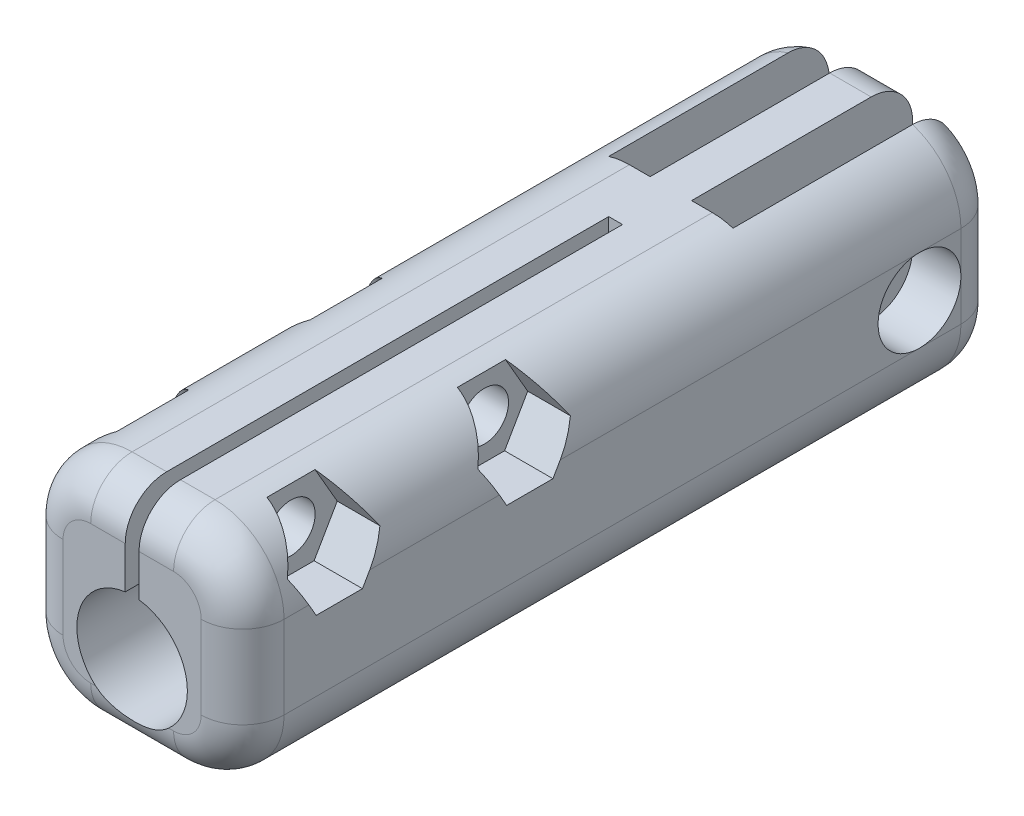
from build123d import *

# Parameters (mm, degrees)
SKETCH1_W               = 16
SKETCH1_H               = 16
BOSS_EXTRUDE1_DEPTH     = 55
SKETCH2_W               = 3
SKETCH2_H               = 16
CUT_EXTRUDE1_DEPTH      = 45
SKETCH3_R               = 3
CUT_EXTRUDE2_DEPTH      = 45
CUT_EXTRUDE3_DEPTH      = 35
FILLET1_R               = 5
FILLET2_R               = 3
CUT_EXTRUDE4_DEPTH      = 40
CUT_EXTRUDE4_DEPTH_BACK = 40
SKETCH5_R               = 1.75
CUT_EXTRUDE5_START      = -4
CUT_EXTRUDE5_DEPTH      = 40
CUT_EXTRUDE6_START      = -5
SKETCH7_R               = 3.5
CUT_EXTRUDE6_DEPTH      = 40


# Some blends are built 0.0001 mm under size
with BuildPart() as part:
    # Sketch1 → Boss-Extrude1 (new body)
    with BuildSketch(Plane.XY):
        Rectangle(SKETCH1_W, SKETCH1_H)
    extrude(amount=BOSS_EXTRUDE1_DEPTH)

    # Sketch2 → Cut-Extrude1 (cut)
    with BuildSketch(Plane(origin=(0, 8, 0), x_dir=(1, 0, 0), z_dir=(0, 1, 0))):
        with Locations((3, -8)):
            Rectangle(SKETCH2_W, SKETCH2_H)
        with Locations((-3, -8)):
            Rectangle(SKETCH2_W, SKETCH2_H)
    extrude(amount=-CUT_EXTRUDE1_DEPTH, mode=Mode.SUBTRACT)

    # Sketch3 → Cut-Extrude2 (cut)
    with BuildSketch(Plane(origin=(8, 0, 0), x_dir=(0, 0, -1), z_dir=(1, 0, 0))):
        with Locations((-6, 0)):
            Circle(SKETCH3_R)
    extrude(amount=-CUT_EXTRUDE2_DEPTH, mode=Mode.SUBTRACT)

    # Sketch4 → Cut-Extrude3 (cut)
    with BuildSketch(Plane.XY.offset(55)):
        with BuildLine():
            Line((0.5, 1.968626967), (0.5, 0.424558432))
            Line((0.5, 0.424558432), (-0.5, 0.424558432))
            Line((-0.5, 0.424558432), (-0.5, 1.968626967))
            ThreePointArc((-0.5, 1.968626967), (-2.645751311, -5), (4, -2))
            ThreePointArc((4, -2), (3, 0.645751311), (0.5, 1.968626967))
        make_face()
        with BuildLine():
            Line((-0.5, 0.424558432), (0.5, 0.424558432))
            Line((0.5, 0.424558432), (0.5, 1.968626967))
            ThreePointArc((0.5, 1.968626967), (0, 2), (-0.5, 1.968626967))
            Line((-0.5, 1.968626967), (-0.5, 0.424558432))
        make_face()
        with BuildLine():
            ThreePointArc((-0.5, 1.968626967), (0, 2), (0.5, 1.968626967))
            Line((0.5, 1.968626967), (0.5, 8))
            Line((0.5, 8), (-0.5, 8))
            Line((-0.5, 8), (-0.5, 1.968626967))
        make_face()
    extrude(amount=-CUT_EXTRUDE3_DEPTH, mode=Mode.SUBTRACT)

    # Fillet1
    fillet1_edges = [part.edges().sort_by_distance(p)[0] for p in [
        (8, 8, 27.5),
        (-8, 8, 27.5),
        (8, -8, 27.5),
        (-8, -8, 27.5),
    ]]
    fillet(fillet1_edges, radius=FILLET1_R - 0.0001)  # a hair under: the kernel refuses the full size

    # Fillet2
    # the kernel refuses this fillet: 3 mm, written as the material it takes off along each edge
    with BuildSketch(Plane(origin=(9, 8, 0), x_dir=(0, -1, 0), z_dir=(-1, 0, 0))) as fillet2_piece_1:
        with BuildLine():
            CenterArc((FILLET2_R, FILLET2_R), FILLET2_R, 180, 90)
            Line((0, FILLET2_R), (0, 0))
            Line((0, 0), (FILLET2_R, 0))
        make_face()
    extrude(amount=18, mode=Mode.SUBTRACT)
    with BuildSketch(Plane(origin=(-9, -8, 0), x_dir=(0, 0, 1), z_dir=(1, 0, 0))) as fillet2_piece_2:
        with BuildLine():
            CenterArc((FILLET2_R, -FILLET2_R), FILLET2_R, 90, 90)
            Line((0, -FILLET2_R), (0, 0))
            Line((0, 0), (FILLET2_R, 0))
        make_face()
    extrude(amount=18, mode=Mode.SUBTRACT)
    with BuildSketch(Plane(origin=(7, 8, 55), x_dir=(0, -1, 0), z_dir=(-1, 0, 0)), Plane(origin=(3.0001, 8, 55), x_dir=(0, -1, 0), z_dir=(-1, 0, 0))) as fillet2_piece_3:
        with BuildLine():
            CenterArc((FILLET2_R, -FILLET2_R), FILLET2_R, 90, 90)
            Line((0, -FILLET2_R), (0, 0))
            Line((0, 0), (FILLET2_R, 0))
        make_face()
    extrude(amount=10.0001, mode=Mode.SUBTRACT)
    with BuildSketch(Plane(origin=(8, -3.0001, 0), x_dir=(0, 0, 1), z_dir=(0, 1, 0)), Plane(origin=(8, -3.0001, 55), x_dir=(-1, 0, 0), z_dir=(0, 1, 0)), Plane(origin=(-8, 3.0001, 55), x_dir=(1, 0, 0), z_dir=(0, -1, 0))) as fillet2_piece_4:
        with BuildLine():
            CenterArc((FILLET2_R, -FILLET2_R), FILLET2_R, 90, 90)
            Line((0, -FILLET2_R), (0, 0))
            Line((0, 0), (FILLET2_R, 0))
        make_face()
    extrude(amount=6.0002, mode=Mode.SUBTRACT)
    with BuildSketch(Plane(origin=(3.0001, -3.0001, 0), x_dir=(-0.9304882617806061, -0.36632170927820573, 0), z_dir=(-0.36632170927820573, 0.9304882617806061, 0))) as fillet2_piece_5_section:
        with BuildLine():
            CenterArc((4.9999 - FILLET2_R, FILLET2_R), FILLET2_R, 270, 90)
            Line((4.9999 - FILLET2_R, 0), (4.9999, 0))
            Line((4.9999, 0), (4.9999, FILLET2_R))
        make_face()
    fillet2_piece_5 = revolve(axis=Axis((3.0001, -3.0001, 0), (0, 0, 1)), revolution_arc=158.511054393, mode=Mode.PRIVATE)
    fillet2_piece_5 = split(fillet2_piece_5, bisect_by=Plane(origin=(4.5, -5.386535126, 0.726343335), z_dir=(1, 0, 0)), keep=Keep.TOP, mode=Mode.PRIVATE)
    add(fillet2_piece_5, mode=Mode.SUBTRACT)
    with BuildSketch(Plane(origin=(3.0001, 3.0001, 0), x_dir=(1, 0, 0), z_dir=(0, -1, 0))) as fillet2_piece_6_section:
        with BuildLine():
            CenterArc((4.9999 - FILLET2_R, FILLET2_R), FILLET2_R, 270, 90)
            Line((4.9999 - FILLET2_R, 0), (4.9999, 0))
            Line((4.9999, 0), (4.9999, FILLET2_R))
        make_face()
    fillet2_piece_6 = revolve(axis=Axis((3.0001, 3.0001, 0), (0, 0, 1)), revolution_arc=158.511054393, mode=Mode.PRIVATE)
    fillet2_piece_6 = split(fillet2_piece_6, bisect_by=Plane(origin=(4.5, 5.386535107, 0.726343714), z_dir=(1, 0, 0)), keep=Keep.TOP, mode=Mode.PRIVATE)
    add(fillet2_piece_6, mode=Mode.SUBTRACT)
    with BuildSketch(Plane(origin=(-3.0001, -8, 55), x_dir=(0, 0, -1), z_dir=(1, 0, 0)), Plane(origin=(-8, 3.0001, 0), x_dir=(1, 0, 0), z_dir=(0, -1, 0))) as fillet2_piece_7:
        with BuildLine():
            CenterArc((FILLET2_R, FILLET2_R), FILLET2_R, 180, 90)
            Line((0, FILLET2_R), (0, 0))
            Line((0, 0), (FILLET2_R, 0))
        make_face()
    extrude(amount=6.0002, mode=Mode.SUBTRACT)
    with BuildSketch(Plane(origin=(-3.0001, -3.0001, 55), x_dir=(0, -1, 0), z_dir=(1, 0, 0))) as fillet2_piece_8:
        with BuildLine():
            CenterArc((4.9999 - FILLET2_R, FILLET2_R), FILLET2_R, 270, 90)
            Line((4.9999 - FILLET2_R, 0), (4.9999, 0))
            Line((4.9999, 0), (4.9999, FILLET2_R))
        make_face()
    revolve(axis=Axis((-3.0001, -3.0001, 55), (0, 0, -1)), revolution_arc=90, mode=Mode.SUBTRACT)
    with BuildSketch(Plane(origin=(3.0001, -3.0001, 55), x_dir=(0, -1, 0), z_dir=(-1, 0, 0))) as fillet2_piece_9:
        with BuildLine():
            CenterArc((4.9999 - FILLET2_R, -FILLET2_R), FILLET2_R, 0, 90)
            Line((4.9999, -FILLET2_R), (4.9999, 0))
            Line((4.9999, 0), (4.9999 - FILLET2_R, 0))
        make_face()
    revolve(axis=Axis((3.0001, -3.0001, 55), (0, 0, 1)), revolution_arc=90, mode=Mode.SUBTRACT)
    with BuildSketch(Plane(origin=(-3.0001, 3.0001, 55), x_dir=(-1, 0, 0), z_dir=(0, -1, 0))) as fillet2_piece_10:
        with BuildLine():
            CenterArc((4.9999 - FILLET2_R, FILLET2_R), FILLET2_R, 270, 90)
            Line((4.9999, FILLET2_R), (4.9999, 0))
            Line((4.9999, 0), (4.9999 - FILLET2_R, 0))
        make_face()
    revolve(axis=Axis((-3.0001, 3.0001, 55), (0, 0, -1)), revolution_arc=90, mode=Mode.SUBTRACT)
    with BuildSketch(Plane(origin=(3.0001, 3.0001, 55), x_dir=(1, 0, 0), z_dir=(0, -1, 0))) as fillet2_piece_11:
        with BuildLine():
            CenterArc((4.9999 - FILLET2_R, -FILLET2_R), FILLET2_R, 0, 90)
            Line((4.9999, -FILLET2_R), (4.9999, 0))
            Line((4.9999, 0), (4.9999 - FILLET2_R, 0))
        make_face()
    revolve(axis=Axis((3.0001, 3.0001, 55), (0, 0, 1)), revolution_arc=90, mode=Mode.SUBTRACT)
    with BuildSketch(Plane(origin=(-3.0001, -3.0001, 0), x_dir=(0.9304882617806057, -0.3663217092782066, 0), z_dir=(0.3663217092782066, 0.9304882617806057, 0))) as fillet2_piece_12_section:
        with BuildLine():
            CenterArc((4.9999 - FILLET2_R, -FILLET2_R), FILLET2_R, 0, 90)
            Line((4.9999 - FILLET2_R, 0), (4.9999, 0))
            Line((4.9999, 0), (4.9999, -FILLET2_R))
        make_face()
    fillet2_piece_12 = revolve(axis=Axis((-3.0001, -3.0001, 0), (0, 0, -1)), revolution_arc=158.511054393, mode=Mode.PRIVATE)
    fillet2_piece_12 = split(fillet2_piece_12, bisect_by=Plane(origin=(-4.5, -5.38653512, 0.72634326), z_dir=(-1, 0, 0)), keep=Keep.TOP, mode=Mode.PRIVATE)
    add(fillet2_piece_12, mode=Mode.SUBTRACT)
    with BuildSketch(Plane(origin=(-3.0001, 3.0001, 0), x_dir=(-1, 0, 0), z_dir=(0, -1, 0))) as fillet2_piece_13_section:
        with BuildLine():
            CenterArc((4.9999 - FILLET2_R, -FILLET2_R), FILLET2_R, 0, 90)
            Line((4.9999 - FILLET2_R, 0), (4.9999, 0))
            Line((4.9999, 0), (4.9999, -FILLET2_R))
        make_face()
    fillet2_piece_13 = revolve(axis=Axis((-3.0001, 3.0001, 0), (0, 0, -1)), revolution_arc=158.511054393, mode=Mode.PRIVATE)
    fillet2_piece_13 = split(fillet2_piece_13, bisect_by=Plane(origin=(-4.5, 5.386535101, 0.726343639), z_dir=(-1, 0, 0)), keep=Keep.TOP, mode=Mode.PRIVATE)
    add(fillet2_piece_13, mode=Mode.SUBTRACT)

    # Sketch5 → Cut-Extrude4 (cut, two sides: drawn at the far end of the back side and taken through both)
    with BuildSketch(Plane.ZY.offset(-0.5).offset(-CUT_EXTRUDE4_DEPTH_BACK)):
        with Locations(Location((48, 4.984313483, 0), (0, 0, 90))):
            Circle(SKETCH5_R)
        with Locations(Location((34, 4.984313483, 0), (0, 0, 90))):
            Circle(SKETCH5_R)
    extrude(amount=CUT_EXTRUDE4_DEPTH + CUT_EXTRUDE4_DEPTH_BACK, mode=Mode.SUBTRACT)

    # Sketch6 → Cut-Extrude5 (cut)
    with BuildSketch(Plane.ZY.offset(-0.5).offset(CUT_EXTRUDE5_START)):
        Polygon((49.674315781, 7.884313483), (46.325684219, 7.884313483), (44.651368439, 4.984313483), (46.325684219, 2.084313483), (49.674315781, 2.084313483), (51.348631561, 4.984313483), align=None)
        Polygon((35.885086056, 7.884313483), (32.536454495, 7.884313483), (30.862138714, 4.984313483), (32.536454495, 2.084313483), (35.885086056, 2.084313483), (37.559401836, 4.984313483), align=None)
    extrude(amount=-CUT_EXTRUDE5_DEPTH, mode=Mode.SUBTRACT)

    # Sketch7 → Cut-Extrude6 (cut)
    with BuildSketch(Plane(origin=(-0.5, 0, 0), x_dir=(0, 0, -1), z_dir=(1, 0, 0)).offset(CUT_EXTRUDE6_START)):
        with Locations((-48, 4.984313483)):
            Circle(SKETCH7_R)
        with Locations((-34, 4.984313483)):
            Circle(SKETCH7_R)
    extrude(amount=-CUT_EXTRUDE6_DEPTH, mode=Mode.SUBTRACT)


solid = part.part
